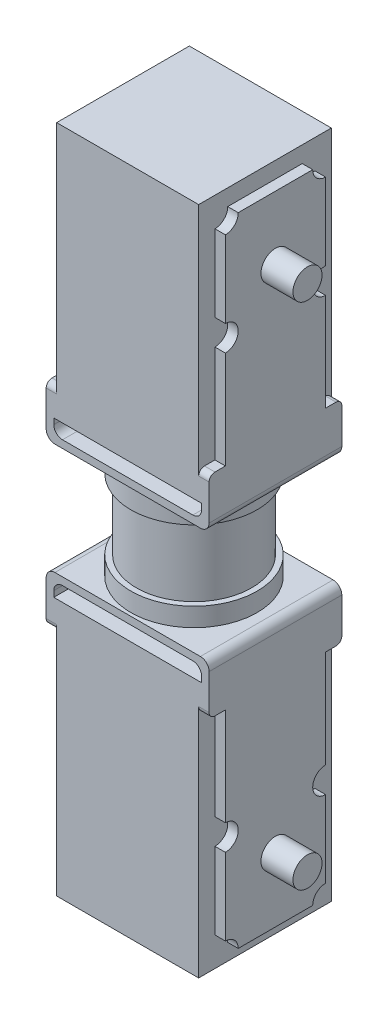
from build123d import *

# Parameters (mm, degrees)
SKETCH1_W            = 28
SKETCH1_H            = 22.8
BOSS_EXTRUDE1_DEPTH  = 48
SKETCH4_R            = 10.85
BOSS_EXTRUDE4_DEPTH  = 3.8
SKETCH5_R            = 9.9
BOSS_EXTRUDE5_DEPTH  = 12.1
SKETCH6_R            = 10.85
BOSS_EXTRUDE6_DEPTH  = 3.2
CUT_EXTRUDE3_DEPTH   = 1.8
FILLET2_R            = 1
FILLET2_OF_MIRROR2_R = 1
SKETCH9_W            = 25.4
SKETCH9_H            = 2.5
CUT_EXTRUDE4_DEPTH   = 25.8
FILLET3_R            = 1.5
SKETCH10_R           = 2.5
BOSS_EXTRUDE7_DEPTH  = 5.5
MIRROR6_START        = -12.2
MIRROR6_OUTLINE_W    = 1.3
MIRROR6_OUTLINE_H    = 22.8
MIRROR6_OUTLINE_W_2  = 44.2
MIRROR6_DEPTH        = 24.4
MIRROR6_START_2      = -14
MIRROR6_2_DEPTH      = 28
MIRROR6_START_3      = -19.5
MIRROR6_3_OUTLINE_R  = 2.5
MIRROR6_3_DEPTH      = 39
MIRROR6_START_4      = -12.5
MIRROR6_4_OUTLINE_W  = 1.3
MIRROR6_4_OUTLINE_H  = 22.8
MIRROR6_4_DEPTH      = 25
MIRROR6_START_5      = -11.4
MIRROR6_5_DEPTH      = 22.8


with BuildPart() as part:
    # Sketch1 → Boss-Extrude1 (new body)
    with BuildSketch(Plane(origin=(0, 0, 0), x_dir=(1, 0, 0), z_dir=(0, 1, 0))):
        Rectangle(SKETCH1_W, SKETCH1_H)
    extrude(amount=BOSS_EXTRUDE1_DEPTH)

    # Sketch4 → Boss-Extrude4 (add)
    with BuildSketch(Plane.XZ):
        with Locations(Location((0, 0, 0), (0, 0, 90))):
            Circle(SKETCH4_R)
    extrude(amount=BOSS_EXTRUDE4_DEPTH)

    # Sketch5 → Boss-Extrude5 (add)
    with BuildSketch(Plane.XZ.offset(3.8)):
        with Locations(Location((0, 0, 0), (0, 0, 270))):
            Circle(SKETCH5_R)
    extrude(amount=BOSS_EXTRUDE5_DEPTH)

    # Sketch6 → Boss-Extrude6 (add)
    with BuildSketch(Plane.XZ.offset(15.9)):
        with Locations(Location((0, 0, 0), (0, 0, 90))):
            Circle(SKETCH6_R)
    extrude(amount=BOSS_EXTRUDE6_DEPTH)

    # Sketch8 → Cut-Extrude3 (cut)
    with BuildSketch(Plane(origin=(14, 0, 0), x_dir=(0, 0, -1), z_dir=(1, 0, 0))):
        with BuildLine():
            Line((8.6, 8.6), (11.4, 8.6))
            Line((11.4, 8.6), (11.4, 48))
            Line((11.4, 48), (-11.4, 48))
            Line((-11.4, 48), (-11.4, 8.6))
            Line((-11.4, 8.6), (-8.6, 8.6))
            Line((-8.6, 8.6), (-8.6, 25.4))
            ThreePointArc((-8.6, 25.4), (-6.4, 27.6), (-8.6, 29.8))
            Line((-8.6, 29.8), (-8.6, 43))
            ThreePointArc((-8.6, 43), (-7.044365081, 43.644365081), (-6.4, 45.2))
            Line((-6.4, 45.2), (6.4, 45.2))
            ThreePointArc((6.4, 45.2), (7.044365081, 43.644365081), (8.6, 43))
            Line((8.6, 43), (8.6, 29.8))
            ThreePointArc((8.6, 29.8), (6.4, 27.6), (8.6, 25.4))
            Line((8.6, 25.4), (8.6, 8.6))
        make_face()
    cut_extrude3 = extrude(amount=-CUT_EXTRUDE3_DEPTH, mode=Mode.SUBTRACT)

    # Fillet2
    fillet2_edges = [part.edges().sort_by_distance(p)[0] for p in [
        (13.1, 8.6, 11.4),
        (13.1, 8.6, -11.4),
    ]]
    fillet(fillet2_edges, radius=FILLET2_R)

    # Mirror2: Cut-Extrude3 across plane
    add(cut_extrude3.mirror(Plane(origin=(0, 0, 0), x_dir=(0, 0, 1), z_dir=(1, 0, 0))), mode=Mode.SUBTRACT)

    # Fillet2 of Mirror2
    fillet2_of_mirror2_edges = [part.edges().sort_by_distance(p)[0] for p in [
        (-13.1, 8.6, 11.4),
        (-13.1, 8.6, -11.4),
    ]]
    fillet(fillet2_of_mirror2_edges, radius=FILLET2_OF_MIRROR2_R)

    # Sketch9 → Cut-Extrude4 (cut)
    with BuildSketch(Plane(origin=(0, 0, -11.4), x_dir=(-1, 0, 0), z_dir=(0, 0, -1))):
        with Locations((0, 2.55)):
            Rectangle(SKETCH9_W, SKETCH9_H)
    extrude(amount=-CUT_EXTRUDE4_DEPTH, mode=Mode.SUBTRACT)

    # Fillet3
    fillet3_edges = [part.edges().sort_by_distance(p)[0] for p in [
        (12.7, 1.3, 0),
        (-12.7, 1.3, 0),
        (-14, 0, 0),
        (14, 0, 0),
    ]]
    fillet(fillet3_edges, radius=FILLET3_R)

    # Sketch10 → Boss-Extrude7 (add)
    with BuildSketch(Plane.ZY.offset(14)):
        with Locations(Location((0, 34.2, 0), (0, 0, 180))):
            Circle(SKETCH10_R)
    boss_extrude7 = extrude(amount=BOSS_EXTRUDE7_DEPTH)

    # Mirror3: Boss-Extrude7 across plane
    add(boss_extrude7.mirror(Plane(origin=(0, 0, 0), x_dir=(0, 0, 1), z_dir=(1, 0, 0))))

    # Mirror6: read off the stored shape, not the designer's step
    # Mirror6 outline → Mirror6 (add)
    with BuildSketch(Plane.YZ.offset(MIRROR6_START)):
        with Locations((-19.75, 0)):
            Rectangle(MIRROR6_OUTLINE_W, MIRROR6_OUTLINE_H)
        with Locations((-45, 0)):
            Rectangle(MIRROR6_OUTLINE_W_2, MIRROR6_OUTLINE_H)
    extrude(amount=MIRROR6_DEPTH)

    # Mirror6 2 outline → Mirror6 2 (add)
    with BuildSketch(Plane.YZ.offset(MIRROR6_START_2)):
        with BuildLine():
            Line((-26.7, -11.4), (-22.9, -11.4))
            Line((-22.9, -11.4), (-22.9, 11.4))
            Line((-22.9, 11.4), (-26.7, 11.4))
            ThreePointArc((-26.7, 11.4), (-27.407106781, 11.107106781), (-27.7, 10.4))
            Line((-27.7, 10.4), (-27.7, 8.6))
            Line((-27.7, 8.6), (-44.5, 8.6))
            ThreePointArc((-44.5, 8.6), (-46.7, 6.4), (-48.9, 8.6))
            Line((-48.9, 8.6), (-62.1, 8.6))
            ThreePointArc((-62.1, 8.6), (-62.744365081, 7.044365081), (-64.3, 6.4))
            Line((-64.3, 6.4), (-64.3, -6.4))
            ThreePointArc((-64.3, -6.4), (-62.744365081, -7.044365081), (-62.1, -8.6))
            Line((-62.1, -8.6), (-48.9, -8.6))
            ThreePointArc((-48.9, -8.6), (-46.7, -6.4), (-44.5, -8.6))
            Line((-44.5, -8.6), (-27.7, -8.6))
            Line((-27.7, -8.6), (-27.7, -10.4))
            ThreePointArc((-27.7, -10.4), (-27.407106781, -11.107106781), (-26.7, -11.4))
        make_face()
    extrude(amount=MIRROR6_2_DEPTH)

    # Mirror6 3 outline → Mirror6 3 (add)
    with BuildSketch(Plane.YZ.offset(MIRROR6_START_3)):
        with Locations((-53.3, 0)):
            Circle(MIRROR6_3_OUTLINE_R)
    extrude(amount=MIRROR6_3_DEPTH)

    # Mirror6 4 outline → Mirror6 4 (add)
    with BuildSketch(Plane.YZ.offset(MIRROR6_START_4)):
        with Locations((-19.75, 0)):
            Rectangle(MIRROR6_4_OUTLINE_W, MIRROR6_4_OUTLINE_H)
    extrude(amount=MIRROR6_4_DEPTH)

    # Mirror6 5 outline → Mirror6 5 (add)
    with BuildSketch(Plane.XY.offset(MIRROR6_START_5)):
        with BuildLine():
            Line((12.7, -21.9), (12.7, -22.9))
            Line((12.7, -22.9), (14, -22.9))
            Line((14, -22.9), (14, -20.6))
            ThreePointArc((14, -20.6), (13.560660172, -19.539339828), (12.5, -19.1))
            Line((12.5, -19.1), (12.5, -20.4))
            Line((12.5, -20.4), (11.2, -20.4))
            ThreePointArc((11.2, -20.4), (12.260660172, -20.839339828), (12.7, -21.9))
        make_face()
        with BuildLine():
            Line((-14, -22.9), (-12.7, -22.9))
            Line((-12.7, -22.9), (-12.7, -21.9))
            ThreePointArc((-12.7, -21.9), (-12.260660172, -20.839339828), (-11.2, -20.4))
            Line((-11.2, -20.4), (-12.5, -20.4))
            Line((-12.5, -20.4), (-12.5, -19.1))
            ThreePointArc((-12.5, -19.1), (-13.560660172, -19.539339828), (-14, -20.6))
            Line((-14, -20.6), (-14, -22.9))
        make_face()
    extrude(amount=MIRROR6_5_DEPTH)


solid = part.part
